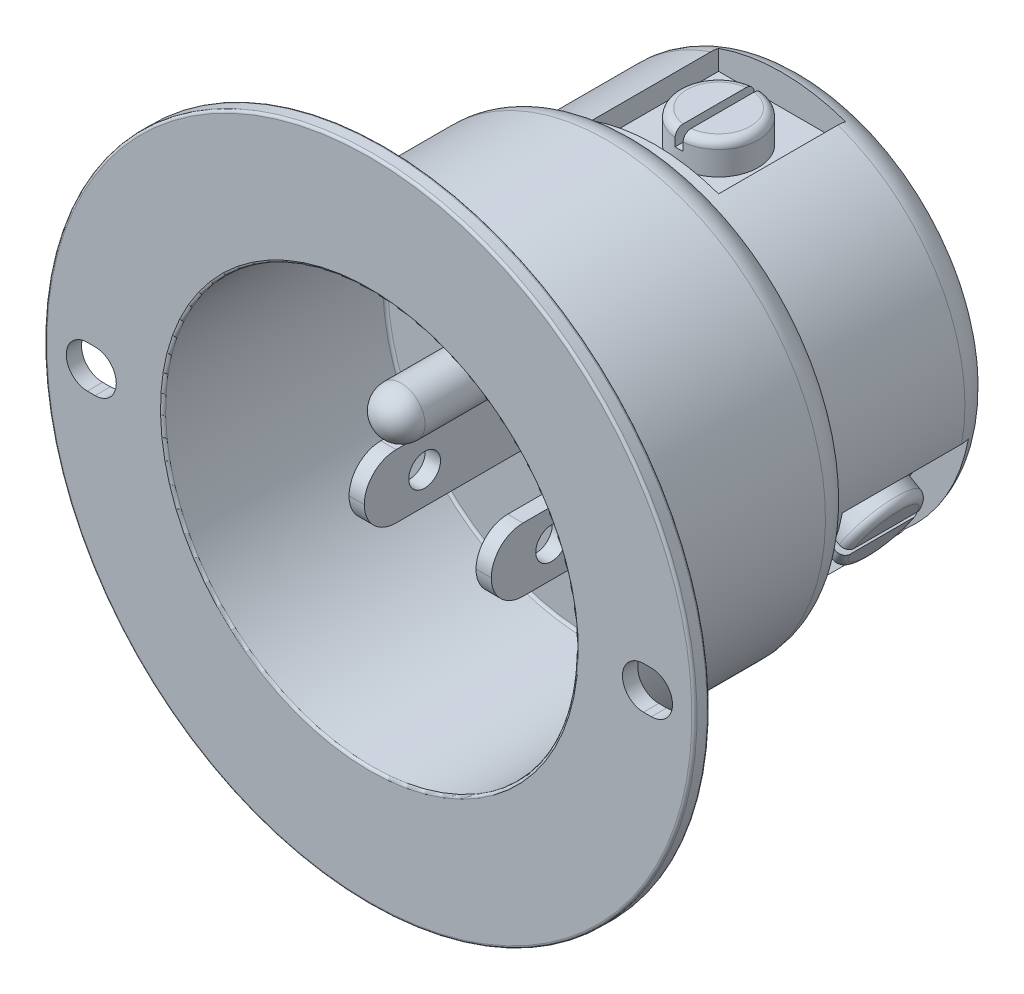
from build123d import *

# Parameters (mm, degrees)
SKETCH9_R                                = 20.6375
SOCKET_RECESS_DEPTH                      = 22.225
SKETCH10_W                               = 1.524
SKETCH10_H                               = 6.35
MAIN_BLADES_DEPTH                        = 17.145
MAIN_BLADE_CROSS_HOLE_REACH              = 69.348
SKETCH15_R                               = 1.5875
SKETCH12_R                               = 2.3876
GROUND_PIN_DEPTH                         = 19.05
F_19_START                               = -1.524
F_19_0_166_DIAMETER_MOUNTING_SLOTS_DEPTH = 1.524
SKETCH16_W                               = 12.7
SKETCH16_H                               = 12.7
TERMINAL_CUT_DEPTH                       = 3.175
SKETCH17_R                               = 3.96875
TERMINAL_SCREW_DEPTH                     = 3.175
SKETCH18_W                               = 0.79375
SKETCH18_H                               = 7.9375
SCREW_SLOT_DEPTH                         = 1.5875
SCREW_FILLET_R                           = 0.79375
TERMINAL_PATTERN_COUNT                   = 3
SCREW_FILLET_OF_TERMINAL_PATTERN_R       = 0.79375
FILLET4_R                                = 3.175
FILLET5_R                                = 3.175
FILLET6_R                                = 0.254


with BuildPart() as part:
    # Sketch1 → Revolve1 (revolve)
    with BuildSketch(Plane(origin=(0, 0, 0), x_dir=(0, 0, -1), z_dir=(1, 0, 0))):
        Polygon((1.524, 32.512), (1.524, 21.844), (26.924, 21.844), (26.924, 19.05), (43.688, 19.05), (43.688, 0), (0, 0), (0, 32.512), align=None)
    revolve(axis=Axis((0, 0, -43.688), (0, 0, 1)))

    # Sketch9 → Socket Recess (cut)
    with BuildSketch(Plane.XY):
        Circle(SKETCH9_R)
    extrude(amount=-SOCKET_RECESS_DEPTH, mode=Mode.SUBTRACT)

    # Sketch10 → Main Blades (add)
    with BuildSketch(Plane.XY.offset(-22.225)):
        with Locations((-6.35, -3.175)):
            Rectangle(SKETCH10_W, SKETCH10_H)
        with Locations((6.35, -3.175)):
            Rectangle(SKETCH10_W, SKETCH10_H)
    extrude(amount=MAIN_BLADES_DEPTH)

    # Main Blade Cross Hole: up to this face of the body (flat: up to its plane)
    main_blade_cross_hole_end = Plane(part.part.faces().sort_by_distance((7.112, -3.175, -13.6525))[0])
    # Sketch15 → Main Blade Cross Hole (cut, up to the picked face)
    with BuildSketch(Plane(origin=(-7.112, 0, 0), x_dir=(0, 0, -1), z_dir=(1, 0, 0)), mode=Mode.PRIVATE) as main_blade_cross_hole_sk1:
        with Locations(Location((11.1125, -3.175, 0), (0, 0, 180))):
            Circle(SKETCH15_R)
    main_blade_cross_hole_tool1 = split(extrude(main_blade_cross_hole_sk1.sketch, amount=MAIN_BLADE_CROSS_HOLE_REACH, mode=Mode.PRIVATE), bisect_by=main_blade_cross_hole_end, keep=Keep.BOTH, mode=Mode.PRIVATE)
    add(main_blade_cross_hole_tool1.solids().sort_by(Axis((-7.112, -3.175, -11.1125), (1, 0, 0)))[0], mode=Mode.SUBTRACT)

    # Sketch12 → Ground Pin (add)
    with BuildSketch(Plane(origin=(-4.243328269, 1.362052024, -22.225), x_dir=(1, 0, 0), z_dir=(0, 0, 1))):
        with Locations(Location((4.243328269, 7.350147976, 0), (0, 0, 180))):
            Circle(SKETCH12_R)
    extrude(amount=GROUND_PIN_DEPTH)

    # Ground Dome: read off the stored shape, not the designer's step
    # Ground Dome outline → Ground Dome (revolve)
    with BuildSketch(Plane.XZ.offset(-8.7122)):
        with BuildLine():
            Line((0, -3.175), (2.3876, -3.175000002))
            ThreePointArc((2.3876, -3.175000002), (1.688288152, -1.48671185), (0, -0.7874))
            Line((0, -0.7874), (0, -3.175))
        make_face()
    revolve(axis=Axis((0, 8.7122, 0), (0, 0, 1)))

    # #19 (0.166) Diameter Mounting Slots: read off the stored shape, not the designer's step
    # #19 (0.166) Diameter Mounting Slots outli → #19 (0.166) Diameter Mounting Slots (cut)
    with BuildSketch(Plane.XY.offset(F_19_START)):
        with BuildLine():
            Line((27.421205, -2.1082), (28.204795, -2.1082))
            ThreePointArc((28.204795, -2.1082), (30.312995, 0), (28.204795, 2.1082))
            Line((28.204795, 2.1082), (27.421205, 2.1082))
            ThreePointArc((27.421205, 2.1082), (25.313005, 0), (27.421205, -2.1082))
        make_face()
        with BuildLine():
            ThreePointArc((-27.421205, -2.1082), (-25.313005, 0), (-27.421205, 2.1082))
            Line((-27.421205, 2.1082), (-28.204795, 2.1082))
            ThreePointArc((-28.204795, 2.1082), (-30.312995, 0), (-28.204795, -2.1082))
            Line((-28.204795, -2.1082), (-27.421205, -2.1082))
        make_face()
    extrude(amount=F_19_0_166_DIAMETER_MOUNTING_SLOTS_DEPTH, mode=Mode.SUBTRACT)

    # Sketch16 → Terminal Cut (cut)
    with BuildSketch(Plane(origin=(0, 19.05, 0), x_dir=(1, 0, 0), z_dir=(0, 1, 0))):
        with Locations((0, 34.925)):
            Rectangle(SKETCH16_W, SKETCH16_H)
    terminal_cut = extrude(amount=-TERMINAL_CUT_DEPTH, mode=Mode.SUBTRACT)

    # Sketch17 → Terminal Screw (add)
    with BuildSketch(Plane(origin=(0, 15.875, 0), x_dir=(-1, 0, 0), z_dir=(0, 1, 0))):
        with Locations(Location((0, -34.925, 0), (0, 0, 270))):
            Circle(SKETCH17_R)
    terminal_screw = extrude(amount=TERMINAL_SCREW_DEPTH)

    # Sketch18 → Screw Slot (cut)
    with BuildSketch(Plane(origin=(0, 19.05, 0), x_dir=(-1, 0, 0), z_dir=(0, 1, 0))):
        with Locations((0, -34.925)):
            Rectangle(SKETCH18_W, SKETCH18_H)
    screw_slot = extrude(amount=-SCREW_SLOT_DEPTH, mode=Mode.SUBTRACT)

    # Screw Fillet
    screw_fillet_edges = [part.edges().sort_by_distance(p)[0] for p in [
        (3.96875, 19.05, -34.925),
        (-3.96875, 19.05, -34.925),
    ]]
    fillet(screw_fillet_edges, radius=SCREW_FILLET_R)

    # Terminal Pattern: Terminal Cut, Terminal Screw, Screw Slot ×3 about axis
    terminal_pattern_axis = Axis((0, 0, 0), (0, 0, 1))
    add([terminal_cut.rotate(terminal_pattern_axis, i * 360 / TERMINAL_PATTERN_COUNT) for i in range(1, TERMINAL_PATTERN_COUNT)], mode=Mode.SUBTRACT)
    add([terminal_screw.rotate(terminal_pattern_axis, i * 360 / TERMINAL_PATTERN_COUNT) for i in range(1, TERMINAL_PATTERN_COUNT)])
    add([screw_slot.rotate(terminal_pattern_axis, i * 360 / TERMINAL_PATTERN_COUNT) for i in range(1, TERMINAL_PATTERN_COUNT)], mode=Mode.SUBTRACT)

    # Screw Fillet of Terminal Pattern
    screw_fillet_of_terminal_pattern_edges = [part.edges().sort_by_distance(p)[0] for p in [
        (-18.482158942, -6.087961679, -34.925),
        (-14.513408942, -12.962038321, -34.925),
        (14.513408942, -12.962038321, -34.925),
        (18.482158942, -6.087961679, -34.925),
    ]]
    fillet(screw_fillet_of_terminal_pattern_edges, radius=SCREW_FILLET_OF_TERMINAL_PATTERN_R)

    # Fillet4
    fillet4_edges = [part.edges().sort_by_distance(p)[0] for p in [
        (-6.35, -6.35, -5.08),
        (-6.35, 0, -5.08),
        (6.35, -6.35, -5.08),
        (6.35, 0, -5.08),
    ]]
    fillet(fillet4_edges, radius=FILLET4_R - 0.0001)  # a hair under: the kernel refuses the full size

    # Fillet5
    # the kernel refuses this fillet: 3.175 mm, written as the material it takes off along each edge
    with BuildSketch(Plane(origin=(0, 0, -43.688), x_dir=(0, 1, 0), z_dir=(1, 0, 0))) as fillet5_piece_1:
        with BuildLine():
            CenterArc((19.05 - FILLET5_R, FILLET5_R), FILLET5_R, 270, 90)
            Line((19.05 - FILLET5_R, 0), (19.05, 0))
            Line((19.05, 0), (19.05, FILLET5_R))
        make_face()
    revolve(axis=Axis((0, 0, -43.688), (0, 0, 1)), mode=Mode.SUBTRACT)
    with BuildSketch(Plane(origin=(0, 0, -26.924), x_dir=(0, 1, 0), z_dir=(1, 0, 0))) as fillet5_piece_2:
        with BuildLine():
            CenterArc((18.669, 3.152057106), FILLET5_R, 276.892102579, 83.107897421)
            Line((19.05, 0), (21.844, 0))
            Line((21.844, 0), (21.844, 3.152057106))
        make_face()
    revolve(axis=Axis((0, 0, -26.924), (0, 0, 1)), mode=Mode.SUBTRACT)

    # Fillet6
    fillet6_edges = [part.edges().sort_by_distance(p)[0] for p in [
        (-20.6375, 0, -22.225),
        (-20.6375, 0, 0),
        (0, -32.512, -1.524),
        (0, -21.844, -1.524),
        (0, -32.512, 0),
    ]]
    fillet(fillet6_edges, radius=FILLET6_R)


solid = part.part
